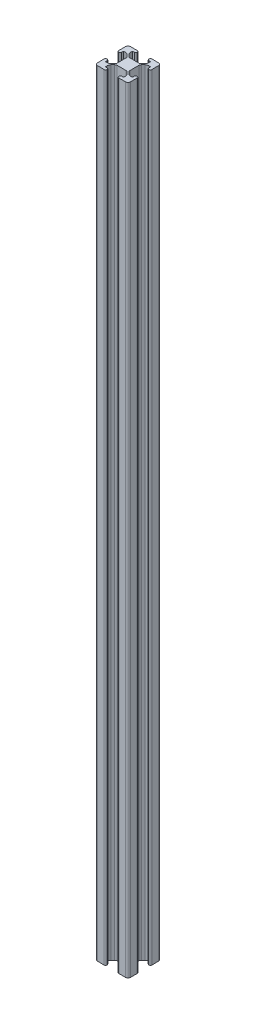
from build123d import *

# Parameters (mm, degrees)
BOSS_EXTRUDE1_DEPTH = 470


with BuildPart() as part:
    # Sketch2 → Boss-Extrude1 (new body)
    with BuildSketch(Plane(origin=(0, 0, 0), x_dir=(1, 0, 0), z_dir=(0, 1, 0))):
        with BuildLine():
            Line((-5.4, 4.869669914), (-4.339339828, 3.809009742))
            ThreePointArc((-4.339339828, 3.809009742), (-4.014180701, 3.322374719), (-3.9, 2.748349571))
            Line((-3.9, 2.748349571), (-3.9, -2.748349571))
            ThreePointArc((-3.9, -2.748349571), (-4.014180701, -3.322374719), (-4.339339828, -3.809009742))
            Line((-4.339339828, -3.809009742), (-5.4, -4.869669914))
            ThreePointArc((-5.4, -4.869669914), (-6.246412561, -5.337861749), (-7.2, -5.5))
            Line((-7.2, -5.5), (-8.2, -5.5))
            Line((-8.2, -5.5), (-8.2, -4.4))
            ThreePointArc((-8.2, -4.4), (-8.434314575, -3.834314575), (-9, -3.6))
            Line((-9, -3.6), (-9.2, -3.6))
            ThreePointArc((-9.2, -3.6), (-9.765685425, -3.834314575), (-10, -4.4))
            Line((-10, -4.4), (-10, -8.5))
            ThreePointArc((-10, -8.5), (-9.560660172, -9.560660172), (-8.5, -10))
            Line((-8.5, -10), (-4.4, -10))
            ThreePointArc((-4.4, -10), (-3.834314575, -9.765685425), (-3.6, -9.2))
            Line((-3.6, -9.2), (-3.6, -9))
            ThreePointArc((-3.6, -9), (-3.834314575, -8.434314575), (-4.4, -8.2))
            Line((-4.4, -8.2), (-5.5, -8.2))
            Line((-5.5, -8.2), (-5.5, -7.2))
            ThreePointArc((-5.5, -7.2), (-5.337861749, -6.246412561), (-4.869669914, -5.4))
            Line((-4.869669914, -5.4), (-3.809009742, -4.339339828))
            ThreePointArc((-3.809009742, -4.339339828), (-3.322374719, -4.014180701), (-2.748349571, -3.9))
            Line((-2.748349571, -3.9), (2.748349571, -3.9))
            ThreePointArc((2.748349571, -3.9), (3.322374719, -4.014180701), (3.809009742, -4.339339828))
            Line((3.809009742, -4.339339828), (4.869669914, -5.4))
            ThreePointArc((4.869669914, -5.4), (5.337861749, -6.246412561), (5.5, -7.2))
            Line((5.5, -7.2), (5.5, -8.2))
            Line((5.5, -8.2), (4.4, -8.2))
            ThreePointArc((4.4, -8.2), (3.834314575, -8.434314575), (3.6, -9))
            Line((3.6, -9), (3.6, -9.2))
            ThreePointArc((3.6, -9.2), (3.834314575, -9.765685425), (4.4, -10))
            Line((4.4, -10), (8.5, -10))
            ThreePointArc((8.5, -10), (9.560660172, -9.560660172), (10, -8.5))
            Line((10, -8.5), (10, -4.4))
            ThreePointArc((10, -4.4), (9.765685425, -3.834314575), (9.2, -3.6))
            Line((9.2, -3.6), (9, -3.6))
            ThreePointArc((9, -3.6), (8.434314575, -3.834314575), (8.2, -4.4))
            Line((8.2, -4.4), (8.2, -5.5))
            Line((8.2, -5.5), (7.2, -5.5))
            ThreePointArc((7.2, -5.5), (6.246412561, -5.337861749), (5.4, -4.869669914))
            Line((5.4, -4.869669914), (4.339339828, -3.809009742))
            ThreePointArc((4.339339828, -3.809009742), (4.014180701, -3.322374719), (3.9, -2.748349571))
            Line((3.9, -2.748349571), (3.9, 2.748349571))
            ThreePointArc((3.9, 2.748349571), (4.014180701, 3.322374719), (4.339339828, 3.809009742))
            Line((4.339339828, 3.809009742), (5.4, 4.869669914))
            ThreePointArc((5.4, 4.869669914), (6.246412561, 5.337861749), (7.2, 5.5))
            Line((7.2, 5.5), (8.2, 5.5))
            Line((8.2, 5.5), (8.2, 4.4))
            ThreePointArc((8.2, 4.4), (8.434314575, 3.834314575), (9, 3.6))
            Line((9, 3.6), (9.2, 3.6))
            ThreePointArc((9.2, 3.6), (9.765685425, 3.834314575), (10, 4.4))
            Line((10, 4.4), (10, 8.5))
            ThreePointArc((10, 8.5), (9.560660172, 9.560660172), (8.5, 10))
            Line((8.5, 10), (4.4, 10))
            ThreePointArc((4.4, 10), (3.834314575, 9.765685425), (3.6, 9.2))
            Line((3.6, 9.2), (3.6, 9))
            ThreePointArc((3.6, 9), (3.834314575, 8.434314575), (4.4, 8.2))
            Line((4.4, 8.2), (5.5, 8.2))
            Line((5.5, 8.2), (5.5, 7.2))
            ThreePointArc((5.5, 7.2), (5.337861749, 6.246412561), (4.869669914, 5.4))
            Line((4.869669914, 5.4), (3.809009742, 4.339339828))
            ThreePointArc((3.809009742, 4.339339828), (3.322374719, 4.014180701), (2.748349571, 3.9))
            Line((2.748349571, 3.9), (-2.748349571, 3.9))
            ThreePointArc((-2.748349571, 3.9), (-3.322374719, 4.014180701), (-3.809009742, 4.339339828))
            Line((-3.809009742, 4.339339828), (-4.869669914, 5.4))
            ThreePointArc((-4.869669914, 5.4), (-5.337861749, 6.246412561), (-5.5, 7.2))
            Line((-5.5, 7.2), (-5.5, 8.2))
            Line((-5.5, 8.2), (-4.4, 8.2))
            ThreePointArc((-4.4, 8.2), (-3.834314575, 8.434314575), (-3.6, 9))
            Line((-3.6, 9), (-3.6, 9.2))
            ThreePointArc((-3.6, 9.2), (-3.834314575, 9.765685425), (-4.4, 10))
            Line((-4.4, 10), (-8.5, 10))
            ThreePointArc((-8.5, 10), (-9.560660172, 9.560660172), (-10, 8.5))
            Line((-10, 8.5), (-10, 4.4))
            ThreePointArc((-10, 4.4), (-9.765685425, 3.834314575), (-9.2, 3.6))
            Line((-9.2, 3.6), (-9, 3.6))
            ThreePointArc((-9, 3.6), (-8.434314575, 3.834314575), (-8.2, 4.4))
            Line((-8.2, 4.4), (-8.2, 5.5))
            Line((-8.2, 5.5), (-7.2, 5.5))
            ThreePointArc((-7.2, 5.5), (-6.246412561, 5.337861749), (-5.4, 4.869669914))
        make_face()
    extrude(amount=BOSS_EXTRUDE1_DEPTH)


solid = part.part
